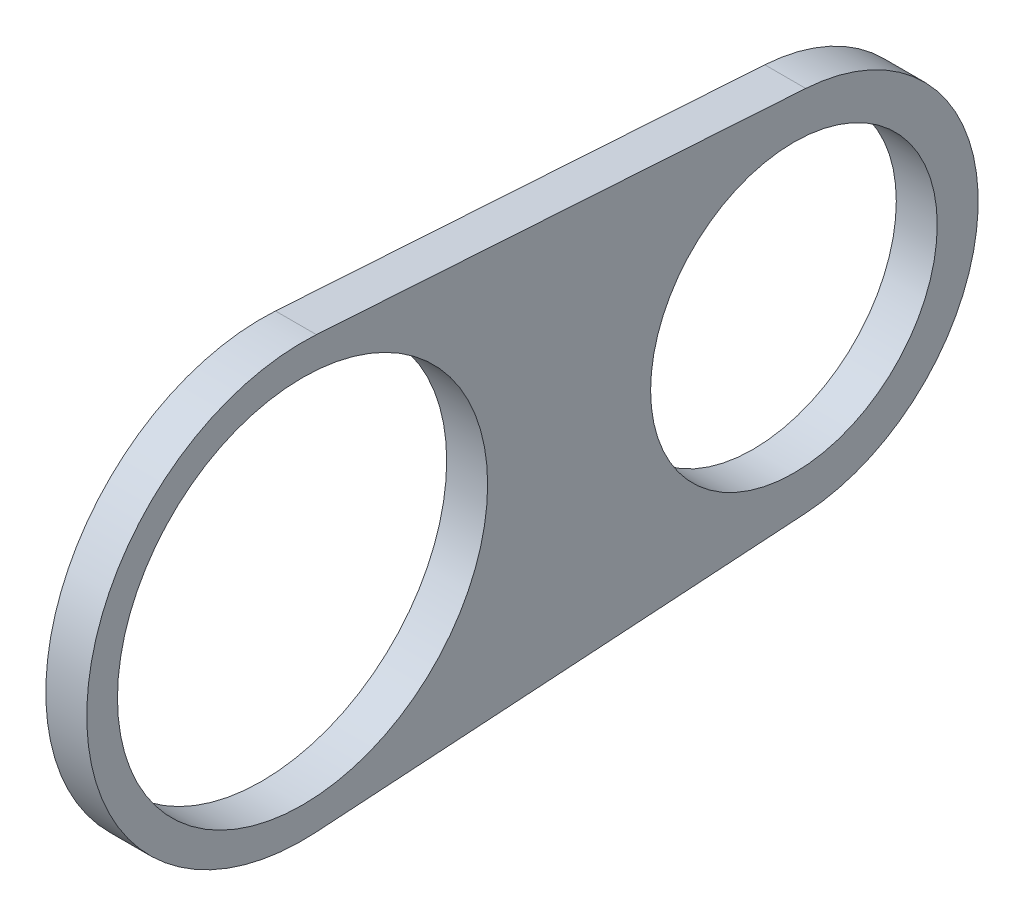
from build123d import *

# Parameters (mm, degrees)
SKETCH1_R           = 14.351
SKETCH1_R_2         = 11.1125
BOSS_EXTRUDE1_DEPTH = 3.175


with BuildPart() as part:
    # Sketch1 → Boss-Extrude1 (new body)
    with BuildSketch(Plane(origin=(0, 0, 0), x_dir=(0, 0, -1), z_dir=(1, 0, 0))):
        with BuildLine():
            Line((-17.976347292, 16.697768112), (19.96678125, 14.258056263))
            ThreePointArc((19.96678125, 14.258056263), (33.3375, 0), (19.96678125, -14.258056263))
            Line((19.96678125, -14.258056263), (-17.976347292, -16.697768112))
            ThreePointArc((-17.976347292, -16.697768112), (-35.78225, 0), (-17.976347292, 16.697768112))
        make_face()
        with Locations((-19.05, 0)):
            Circle(SKETCH1_R, mode=Mode.SUBTRACT)
        with Locations((19.05, 0)):
            Circle(SKETCH1_R_2, mode=Mode.SUBTRACT)
    extrude(amount=BOSS_EXTRUDE1_DEPTH)


solid = part.part
